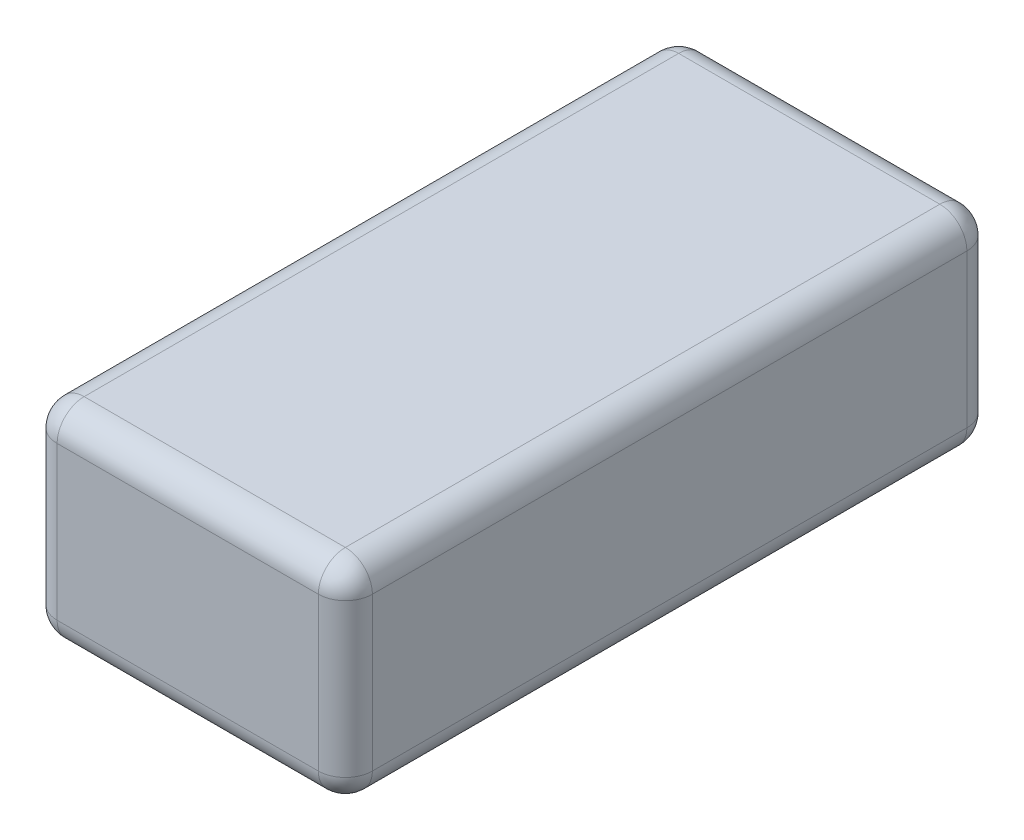
from build123d import *

# Parameters (mm, degrees)
SKETCH1_W           = 35
SKETCH1_H           = 72
BOSS_EXTRUDE1_DEPTH = 23
FILLET1_R           = 3


with BuildPart() as part:
    # Sketch1 → Boss-Extrude1 (new body)
    with BuildSketch(Plane(origin=(0, 0, 0), x_dir=(1, 0, 0), z_dir=(0, 1, 0))):
        Rectangle(SKETCH1_W, SKETCH1_H)
    extrude(amount=BOSS_EXTRUDE1_DEPTH)

    # Fillet1
    fillet1_edges = [part.edges().sort_by_distance(p)[0] for p in [
        (-17.5, 11.5, -36),
        (-17.5, 11.5, 36),
        (17.5, 11.5, 36),
        (17.5, 11.5, -36),
        (0, 0, -36),
        (-17.5, 0, 0),
        (0, 0, 36),
        (17.5, 0, 0),
        (0, 23, 36),
        (-17.5, 23, 0),
        (0, 23, -36),
        (17.5, 23, 0),
    ]]
    fillet(fillet1_edges, radius=FILLET1_R)


solid = part.part
